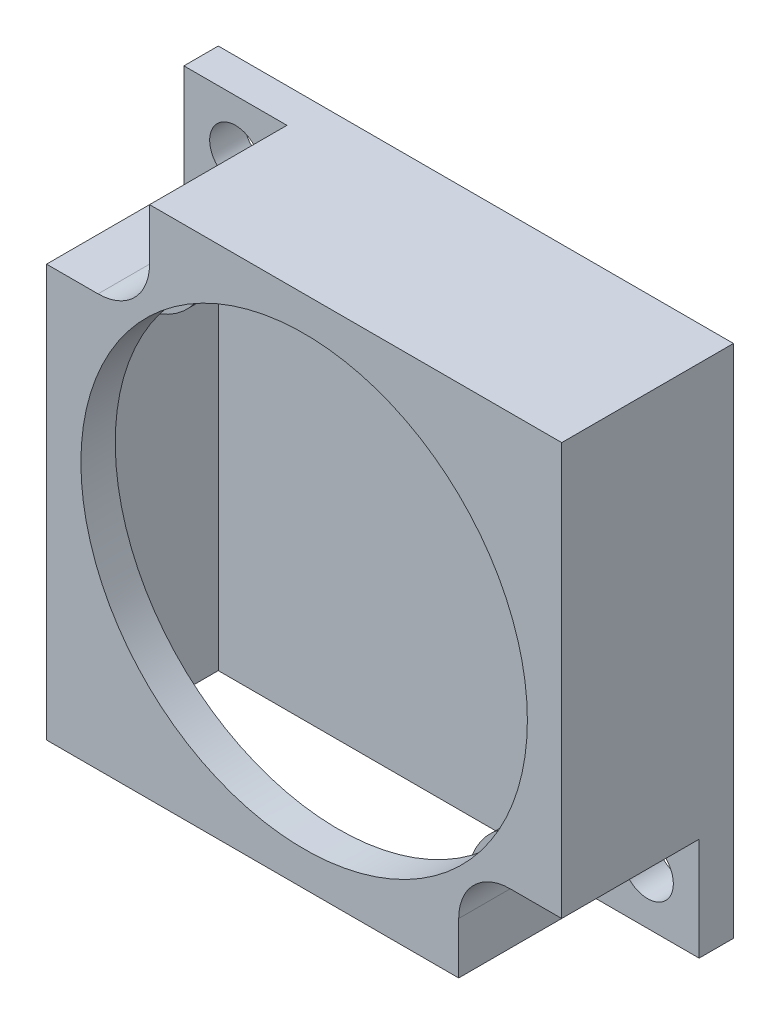
from build123d import *

# Parameters (mm, degrees)
RESSALTO_EXTRUS_O1_DEPTH = 10
ESBO_O1_3_R              = 1.5
RESSALTO_EXTRUS_O2_DEPTH = 2
ESBO_O2_R                = 13
CORTE_EXTRUS_O1_DEPTH    = 2
CASCA1_START             = 1.5
CASCA1_DEPTH             = 6.5
CASCA1_START_2           = 8
CASCA1_2_DEPTH           = 0.5


# Read off the part's stored shape, not the designer's step: Casca1
with BuildPart() as part:
    # Esboço1 → Ressalto-extrusão1 (new body)
    with BuildSketch(Plane.XY):
        with BuildLine():
            Line((-9, 15), (-9, 12))
            ThreePointArc((-9, 12), (-9.878679656, 9.878679656), (-12, 9))
            Line((-12, 9), (-15, 9))
            Line((-15, 9), (-15, -15))
            Line((-15, -15), (9, -15))
            Line((9, -15), (9, -12))
            ThreePointArc((9, -12), (9.878679656, -9.878679656), (12, -9))
            Line((12, -9), (15, -9))
            Line((15, -9), (15, 15))
            Line((15, 15), (-9, 15))
        make_face()
    extrude(amount=RESSALTO_EXTRUS_O1_DEPTH)

    # Esboço1<3> → Ressalto-extrusão2 (add)
    # profile 1 of 2: a face of its own
    with BuildSketch(Plane.XY):
        with BuildLine():
            ThreePointArc((-12, 9), (-9.878679656, 9.878679656), (-9, 12))
            Line((-9, 12), (-9, 15))
            Line((-9, 15), (-15, 15))
            Line((-15, 15), (-15, 9))
            Line((-15, 9), (-12, 9))
        make_face()
        with Locations((-12, 12)):
            Circle(ESBO_O1_3_R, mode=Mode.SUBTRACT)
    # profile 2 of 2: a face of its own
    with BuildSketch(Plane.XY):
        with BuildLine():
            Line((15, -15), (15, -9))
            Line((15, -9), (12, -9))
            ThreePointArc((12, -9), (9.878679656, -9.878679656), (9, -12))
            Line((9, -12), (9, -15))
            Line((9, -15), (15, -15))
        make_face()
        with Locations((12, -12)):
            Circle(ESBO_O1_3_R, mode=Mode.SUBTRACT)
    extrude(amount=RESSALTO_EXTRUS_O2_DEPTH)

    # Esboço2 → Corte-extrusão1 (cut)
    with BuildSketch(Plane.XY.offset(10)):
        Circle(ESBO_O2_R)
    extrude(amount=-CORTE_EXTRUS_O1_DEPTH, mode=Mode.SUBTRACT)

    # Casca1 outline → Casca1 (cut)
    with BuildSketch(Plane.XY.offset(CASCA1_START)):
        with BuildLine():
            Line((-13.5, -15), (7.5, -15))
            Line((7.5, -15), (7.5, -12))
            ThreePointArc((7.5, -12), (8.818019485, -8.818019485), (12, -7.5))
            Line((12, -7.5), (13.5, -7.5))
            Line((13.5, -7.5), (13.5, 13.5))
            Line((13.5, 13.5), (-7.5, 13.5))
            Line((-7.5, 13.5), (-7.5, 12))
            ThreePointArc((-7.5, 12), (-8.818019485, 8.818019485), (-12, 7.5))
            Line((-12, 7.5), (-13.5, 7.5))
            Line((-13.5, 7.5), (-13.5, -15))
        make_face()
    extrude(amount=CASCA1_DEPTH, mode=Mode.SUBTRACT)

    # Casca1 2 outline → Casca1 2 (cut)
    with BuildSketch(Plane.XY.offset(CASCA1_START_2)):
        with BuildLine():
            Line((-13.5, -5.291502622), (-13.5, -15))
            Line((-13.5, -15), (7.5, -15))
            Line((7.5, -15), (7.5, -12.409673646))
            ThreePointArc((7.5, -12.409673646), (-4.65479212, -13.732549302), (-13.5, -5.291502622))
        make_face()
        with BuildLine():
            Line((-13.5, 7.5), (-13.5, 5.291502622))
            ThreePointArc((-13.5, 5.291502622), (-13.001813807, 6.418943661), (-12.409673646, 7.5))
            Line((-12.409673646, 7.5), (-13.5, 7.5))
        make_face()
        with BuildLine():
            ThreePointArc((13.5, -5.291502622), (13.001813807, -6.418943661), (12.409673646, -7.5))
            Line((12.409673646, -7.5), (13.5, -7.5))
            Line((13.5, -7.5), (13.5, -5.291502622))
        make_face()
        with BuildLine():
            Line((-7.5, 13.5), (-7.5, 12.409673646))
            ThreePointArc((-7.5, 12.409673646), (-6.418943661, 13.001813807), (-5.291502622, 13.5))
            Line((-5.291502622, 13.5), (-7.5, 13.5))
        make_face()
        with BuildLine():
            ThreePointArc((5.291502622, 13.5), (10.253048327, 10.253048327), (13.5, 5.291502622))
            Line((13.5, 5.291502622), (13.5, 13.5))
            Line((13.5, 13.5), (5.291502622, 13.5))
        make_face()
    extrude(amount=CASCA1_2_DEPTH, mode=Mode.SUBTRACT)


solid = part.part
